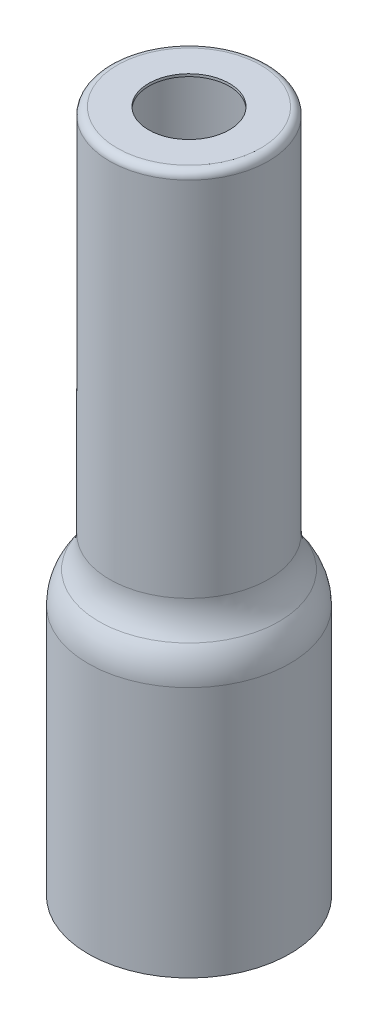
from build123d import *

# Parameters (mm, degrees)
SKETCH_1_R      = 40
SKETCH_1_R_2    = 30
EXTRUDE_1_DEPTH = 43
SKETCH_2_R      = 40
EXTRUDE_2_DEPTH = 65
SKETCH_3_R      = 31.5
SKETCH_3_R_2    = 30.5
EXTRUDE_3_DEPTH = 162
FILLET_1_R      = 20
FILLET_2_R      = 20
SKETCH_4_R      = 31.5
SKETCH_4_R_2    = 16
EXTRUDE_4_DEPTH = 1
FILLET_3_R      = 3


with BuildPart() as part:
    # Эскиз1 → Вытянуть1 (new body)
    with BuildSketch(Plane(origin=(0, 0, 0), x_dir=(1, 0, 0), z_dir=(0, 1, 0))):
        with Locations(Location((0, 0, 0), (0, 0, 270))):
            Circle(SKETCH_1_R)
        with Locations(Location((0, 0, 0), (0, 0, 270))):
            Circle(SKETCH_1_R_2, mode=Mode.SUBTRACT)
    extrude(amount=EXTRUDE_1_DEPTH)

    # Эскиз2 → Вытянуть2 (add)
    with BuildSketch(Plane(origin=(0, 43, 0), x_dir=(1, 0, 0), z_dir=(0, 1, 0))):
        with Locations(Location((0, 0, 0), (0, 0, 270))):
            Circle(SKETCH_2_R)
    extrude(amount=EXTRUDE_2_DEPTH)

    # Эскиз3 → Вытянуть3 (add)
    with BuildSketch(Plane(origin=(0, 108, 0), x_dir=(-1, 0, 0), z_dir=(0, 1, 0))):
        with Locations(Location((0, 0, 0), (0, 0, 90))):
            Circle(SKETCH_3_R)
        with Locations(Location((0, 0, 0), (0, 0, 90))):
            Circle(SKETCH_3_R_2, mode=Mode.SUBTRACT)
    extrude(amount=EXTRUDE_3_DEPTH)

    # Скругление1
    # the kernel refuses this fillet: 20 mm, written as the material it adds along each edge
    with BuildSketch(Plane(origin=(0, 108, 0), x_dir=(0, 0, 1), z_dir=(-1, 0, 0))) as fillet_1_piece_1:
        with BuildLine():
            CenterArc((51.5, 16.363068172), FILLET_1_R, 180, 54.900367805)
            Line((31.5, 16.363068172), (31.1, 16.363068172))
            Line((31.1, 16.363068172), (31.1, 0))
            Line((31.1, 0), (31.5, -0.4))
            ThreePointArc((31.5, -0.4), (35.75, -0.4), (39.77, -0.327261363))
            Line((39.77, -0.327261363), (40, 0))
        make_face()
    revolve(axis=Axis((0, 108, 0), (0, 1, 0)))

    # Скругление2
    fillet_2_edges = [part.edges().sort_by_distance(p)[0] for p in [
        (0, 108, -40),
    ]]
    fillet(fillet_2_edges, radius=FILLET_2_R)

    # Эскиз4 → Вытянуть4 (add)
    with BuildSketch(Plane(origin=(0, 270, 0), x_dir=(-1, 0, 0), z_dir=(0, 1, 0))):
        with Locations(Location((0, 0, 0), (0, 0, 270))):
            Circle(SKETCH_4_R)
        with Locations(Location((0, 0, 0), (0, 0, 90))):
            Circle(SKETCH_4_R_2, mode=Mode.SUBTRACT)
    extrude(amount=EXTRUDE_4_DEPTH)

    # Скругление3
    fillet_3_edges = [part.edges().sort_by_distance(p)[0] for p in [
        (0, 271, 31.5),
    ]]
    fillet(fillet_3_edges, radius=FILLET_3_R)


solid = part.part
